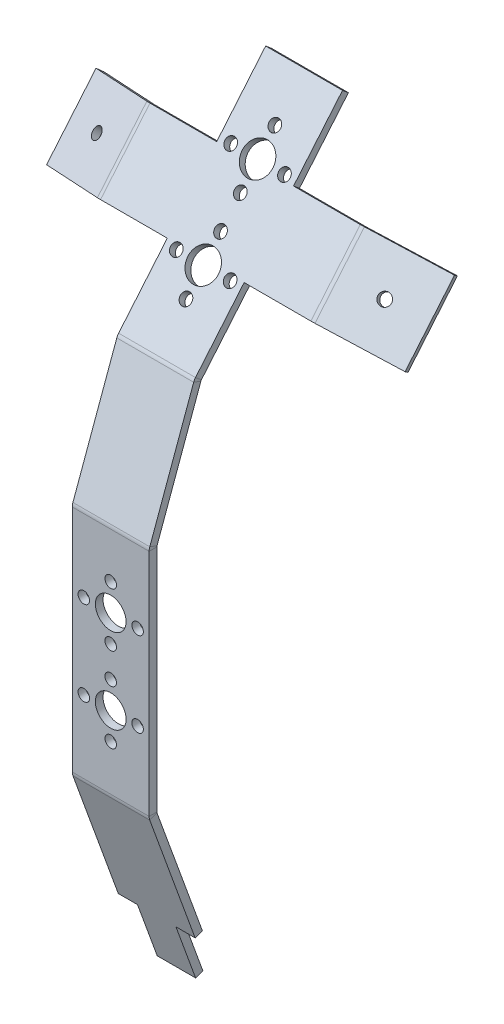
from build123d import *

# Parameters (mm, degrees)
SKETCH1_W                      = 20
SKETCH1_H                      = 60
BASE_FLANGE1_DEPTH             = 2
SKETCH2_R                      = 4
SKETCH2_R_2                    = 1.5
CUT_EXTRUDE1_DEPTH             = 2
EDGE_FLANGE1_STRIP_CUT_DEPTH   = 20
EDGE_FLANGE1_DEPTH             = 20
EDGE_FLANGE2_STRIP_CUT_DEPTH   = 20
EDGE_FLANGE2_DEPTH             = 20
EDGE_FLANGE3_STRIP_CUT_DEPTH   = 20
EDGE_FLANGE3_DEPTH             = 20
EDGE_FLANGE3_START             = 2
EDGE_FLANGE3_FLAT_DEPTH        = 2
EDGE_FLANGE4_STRIP_CUT_DEPTH   = 20
EDGE_FLANGE4_STRIP_CUT_2_DEPTH = 20
EDGE_FLANGE4_DEPTH             = 20
EDGE_FLANGE4_BEND_DEPTH        = 20
SKETCH16_W                     = 5
SKETCH16_H                     = 15
CUT_EXTRUDE2_DEPTH             = 137.190450876
SKETCH23_R                     = 4
SKETCH23_R_2                   = 1.5
CUT_EXTRUDE3_DEPTH             = 10
SKETCH24_R                     = 1.5
CUT_EXTRUDE4_DEPTH             = 10
SKETCH25_R                     = 1.5
CUT_EXTRUDE5_DEPTH             = 10


# Sheet-metal steps are written as plain solids
with BuildPart() as part:
    # Sketch1 → Base-Flange1 (new body)
    with BuildSketch(Plane.XY):
        Rectangle(SKETCH1_W, SKETCH1_H)
    extrude(amount=-BASE_FLANGE1_DEPTH)

    # Sketch2 → Cut-Extrude1 (cut)
    with BuildSketch(Plane.XY):
        with Locations((0, 11)):
            Circle(SKETCH2_R)
        with Locations((0, 18)):
            Circle(SKETCH2_R_2)
        with Locations((7, 11)):
            Circle(SKETCH2_R_2)
        with Locations((0, 4)):
            Circle(SKETCH2_R_2)
        with Locations((-7, 11)):
            Circle(SKETCH2_R_2)
        with Locations(Location((0, -18, 0), (0, 0, 180))):
            Circle(SKETCH2_R_2)
        with Locations(Location((7, -11, 0), (0, 0, 180))):
            Circle(SKETCH2_R_2)
        with Locations(Location((0, -4, 0), (0, 0, 180))):
            Circle(SKETCH2_R_2)
        with Locations(Location((0, -11, 0), (0, 0, 180))):
            Circle(SKETCH2_R)
        with Locations(Location((-7, -11, 0), (0, 0, 180))):
            Circle(SKETCH2_R_2)
    extrude(amount=-CUT_EXTRUDE1_DEPTH, mode=Mode.SUBTRACT)

    # Edge-Flange1 strip (across the edge) → Edge-Flange1 strip cut (cut)
    with BuildSketch(Plane(origin=(-10, 30, -2), x_dir=(0, -0.3420201433256626, -0.9396926207859106), z_dir=(1, 0, 0))):
        Polygon((-5.074988048, 8.095806265), (-1.834962826, -0.80608987), (0.044422416, -0.122049584), (-3.195602806, 8.779846552), align=None)
    extrude(amount=EDGE_FLANGE1_STRIP_CUT_DEPTH, mode=Mode.SUBTRACT)

    # Edge-Flange1 section (across the edge) → Edge-Flange1 (add)
    with BuildSketch(Plane(origin=(-10, 30, -2), x_dir=(0, -0.3420201433256626, -0.9396926207859106), z_dir=(1, 0, 0))):
        with BuildLine():
            Line((-2, 0.129882454), (-2, 33.647346039))
            Line((-2, 33.647346039), (0, 33.647346039))
            Line((0, 33.647346039), (0, 0.129882454))
            ThreePointArc((0, 0.129882454), (0.011190609, 0.001973206), (0.044422416, -0.122049584))
            Line((0.044422416, -0.122049584), (-1.834962826, -0.80608987))
            ThreePointArc((-1.834962826, -0.80608987), (-1.958424897, -0.345323149), (-2, 0.129882454))
        make_face()
    extrude(amount=EDGE_FLANGE1_DEPTH)

    # Edge-Flange2 strip (across the edge) → Edge-Flange2 strip cut (cut)
    with BuildSketch(Plane(origin=(10, -30, -2), x_dir=(0, 0.34202014332566344, -0.9396926207859103), z_dir=(-1, 0, 0))):
        Polygon((-5.074988048, 8.095806265), (-1.834962826, -0.80608987), (0.044422416, -0.122049584), (-3.195602806, 8.779846552), align=None)
    extrude(amount=EDGE_FLANGE2_STRIP_CUT_DEPTH, mode=Mode.SUBTRACT)

    # Edge-Flange2 section (across the edge) → Edge-Flange2 (add)
    with BuildSketch(Plane(origin=(10, -30, -2), x_dir=(0, 0.34202014332566344, -0.9396926207859103), z_dir=(-1, 0, 0))):
        with BuildLine():
            Line((-2, 0.129882454), (-2, 49.647346039))
            Line((-2, 49.647346039), (0, 49.647346039))
            Line((0, 49.647346039), (0, 0.129882454))
            ThreePointArc((0, 0.129882454), (0.011190609, 0.001973206), (0.044422416, -0.122049584))
            Line((0.044422416, -0.122049584), (-1.834962826, -0.80608987))
            ThreePointArc((-1.834962826, -0.80608987), (-1.958424897, -0.345323149), (-2, 0.129882454))
        make_face()
    extrude(amount=EDGE_FLANGE2_DEPTH)

    # Edge-Flange3 strip (across the edge) → Edge-Flange3 strip cut (cut)
    with BuildSketch(Plane(origin=(-10, 61.618162781, -13.508070115), x_dir=(0, -0.6427876096865297, -0.7660444431189862), z_dir=(1, 0, 0))):
        Polygon((-5.074988048, 8.095806265), (-1.834962826, -0.80608987), (0.044422416, -0.122049584), (-3.195602806, 8.779846552), align=None)
    extrude(amount=EDGE_FLANGE3_STRIP_CUT_DEPTH, mode=Mode.SUBTRACT)

    # Edge-Flange3 bend section (across the edge) → Edge-Flange3 (add)
    with BuildSketch(Plane(origin=(-10, 61.618162781, -13.508070115), x_dir=(0, -0.6427876096865297, -0.7660444431189862), z_dir=(1, 0, 0))):
        with BuildLine():
            Line((-2, 0.129882454), (0, 0.129882454))
            ThreePointArc((0, 0.129882454), (0.011190609, 0.001973206), (0.044422416, -0.122049584))
            Line((0.044422416, -0.122049584), (-1.834962826, -0.80608987))
            ThreePointArc((-1.834962826, -0.80608987), (-1.958424897, -0.345323149), (-2, 0.129882454))
        make_face()
    extrude(amount=EDGE_FLANGE3_DEPTH)

    # Edge-Flange3 profile (on flange) → Edge-Flange3 flat (add)
    with BuildSketch(Plane(origin=(0, 61.618162781, -13.508070115), x_dir=(1, 0, 0), z_dir=(0, 0.6427876096865297, 0.7660444431189862)).offset(EDGE_FLANGE3_START)):
        Polygon((10, 0.129882454), (10, 19.823673019), (27.5, 19.823673019), (27.5, 39.823673019), (10, 39.823673019), (10, 59.647346039), (-10, 59.647346039), (-10, 39.823673019), (-27.5, 39.823673019), (-27.5, 19.823673019), (-10, 19.823673019), (-10, 0.129882454), align=None)
    extrude(amount=-EDGE_FLANGE3_FLAT_DEPTH)

    # Edge-Flange4 strip (across the edge) → Edge-Flange4 strip cut (cut)
    with BuildSketch(Plane(origin=(27.5, 92.124866203, -39.106233704), x_dir=(-0.34202014332566305, -0.6040227735550457, -0.7198463103929635), z_dir=(0, -0.7660444431189863, 0.6427876096865295))):
        Polygon((-5.074988048, 8.095806265), (-1.834962826, -0.80608987), (0.044422416, -0.122049584), (-3.195602806, 8.779846552), align=None)
    extrude(amount=EDGE_FLANGE4_STRIP_CUT_DEPTH, mode=Mode.SUBTRACT)

    # Edge-Flange4 strip 2 (across the edge) → Edge-Flange4 strip cut 2 (cut)
    with BuildSketch(Plane(origin=(-27.5, 76.80397734, -26.25048151), x_dir=(0.34202014332566305, -0.6040227735550457, -0.7198463103929635), z_dir=(0, 0.7660444431189863, -0.6427876096865295))):
        Polygon((-5.074988048, 8.095806265), (-1.834962826, -0.80608987), (0.044422416, -0.122049584), (-3.195602806, 8.779846552), align=None)
    extrude(amount=EDGE_FLANGE4_STRIP_CUT_2_DEPTH, mode=Mode.SUBTRACT)

    # Edge-Flange4 section (across the edge) → Edge-Flange4 (add)
    with BuildSketch(Plane(origin=(27.5, 92.124866203, -39.106233704), x_dir=(-0.34202014332566305, -0.6040227735550457, -0.7198463103929635), z_dir=(0, -0.7660444431189863, 0.6427876096865295))):
        with BuildLine():
            Line((-2, 0.129882454), (-2, 19.647346039))
            Line((-2, 19.647346039), (0, 19.647346039))
            Line((0, 19.647346039), (0, 0.129882454))
            ThreePointArc((0, 0.129882454), (0.011190609, 0.001973206), (0.044422416, -0.122049584))
            Line((0.044422416, -0.122049584), (-1.834962826, -0.80608987))
            ThreePointArc((-1.834962826, -0.80608987), (-1.958424897, -0.345323149), (-2, 0.129882454))
        make_face()
    extrude(amount=EDGE_FLANGE4_DEPTH)

    # Edge-Flange4 section 2 (across the edge) → Edge-Flange4 bend (add)
    with BuildSketch(Plane(origin=(-27.5, 76.80397734, -26.25048151), x_dir=(0.34202014332566305, -0.6040227735550457, -0.7198463103929635), z_dir=(0, 0.7660444431189863, -0.6427876096865295))):
        with BuildLine():
            Line((-2, 0.129882454), (-2, 19.647346039))
            Line((-2, 19.647346039), (0, 19.647346039))
            Line((0, 19.647346039), (0, 0.129882454))
            ThreePointArc((0, 0.129882454), (0.011190609, 0.001973206), (0.044422416, -0.122049584))
            Line((0.044422416, -0.122049584), (-1.834962826, -0.80608987))
            ThreePointArc((-1.834962826, -0.80608987), (-1.958424897, -0.345323149), (-2, 0.129882454))
        make_face()
    extrude(amount=EDGE_FLANGE4_BEND_DEPTH)

    # Sketch16 → Cut-Extrude2 (cut, through all)
    with BuildSketch(Plane(origin=(0, -3.55058603, 9.755154944), x_dir=(1, 0, 0), z_dir=(0, -0.3420201433256634, 0.9396926207859103))):
        with Locations((-7.5, -71.022164949)):
            Rectangle(SKETCH16_W, SKETCH16_H)
        with Locations((7.5, -71.022164949)):
            Rectangle(SKETCH16_W, SKETCH16_H)
    extrude(amount=-CUT_EXTRUDE2_DEPTH, mode=Mode.SUBTRACT)

    # Sketch23 → Cut-Extrude3 (cut)
    with BuildSketch(Plane(origin=(0, 20.093289682, 23.946250166), x_dir=(1, 0, 0), z_dir=(0, 0.6427876096865298, 0.7660444431189862))):
        with Locations(Location((0, 96.708744314, 0), (0, 0, 270))):
            Circle(SKETCH23_R)
        with Locations(Location((0, 103.708744314, 0), (0, 0, 270))):
            Circle(SKETCH23_R_2)
        with Locations(Location((7, 96.708744314, 0), (0, 0, 270))):
            Circle(SKETCH23_R_2)
        with Locations(Location((0, 89.708744314, 0), (0, 0, 270))):
            Circle(SKETCH23_R_2)
        with Locations(Location((-7, 96.708744314, 0), (0, 0, 270))):
            Circle(SKETCH23_R_2)
        with Locations(Location((0, 74.708744314, 0), (0, 0, 90))):
            Circle(SKETCH23_R)
        with Locations(Location((7, 74.708744314, 0), (0, 0, 90))):
            Circle(SKETCH23_R_2)
        with Locations(Location((0, 81.708744314, 0), (0, 0, 90))):
            Circle(SKETCH23_R_2)
        with Locations(Location((-7, 74.708744314, 0), (0, 0, 90))):
            Circle(SKETCH23_R_2)
        with Locations(Location((0, 67.708744314, 0), (0, 0, 90))):
            Circle(SKETCH23_R_2)
    extrude(amount=-CUT_EXTRUDE3_DEPTH, mode=Mode.SUBTRACT)

    # Sketch24 → Cut-Extrude4 (cut)
    with BuildSketch(Plane(origin=(-12.620746139, 22.288798586, 26.56275579), x_dir=(-0.9396926207859104, -0.21984631039294733, -0.2620026302293839), z_dir=(0.3420201433256635, -0.6040227735550454, -0.7198463103929638))):
        with Locations(Location((25.690314863, 85.708744314, 0), (0, 0, 90))):
            Circle(SKETCH24_R)
    extrude(amount=-CUT_EXTRUDE4_DEPTH, mode=Mode.SUBTRACT)

    # Sketch25 → Cut-Extrude5 (cut)
    with BuildSketch(Plane(origin=(12.620746139, 22.288798586, 26.56275579), x_dir=(-0.9396926207859105, 0.21984631039294705, 0.26200263022938347), z_dir=(-0.342020143325663, -0.6040227735550456, -0.7198463103929638))):
        with Locations(Location((-25.722785477, 85.708744314, 0), (0, 0, 90))):
            Circle(SKETCH25_R)
    extrude(amount=-CUT_EXTRUDE5_DEPTH, mode=Mode.SUBTRACT)


solid = part.part
